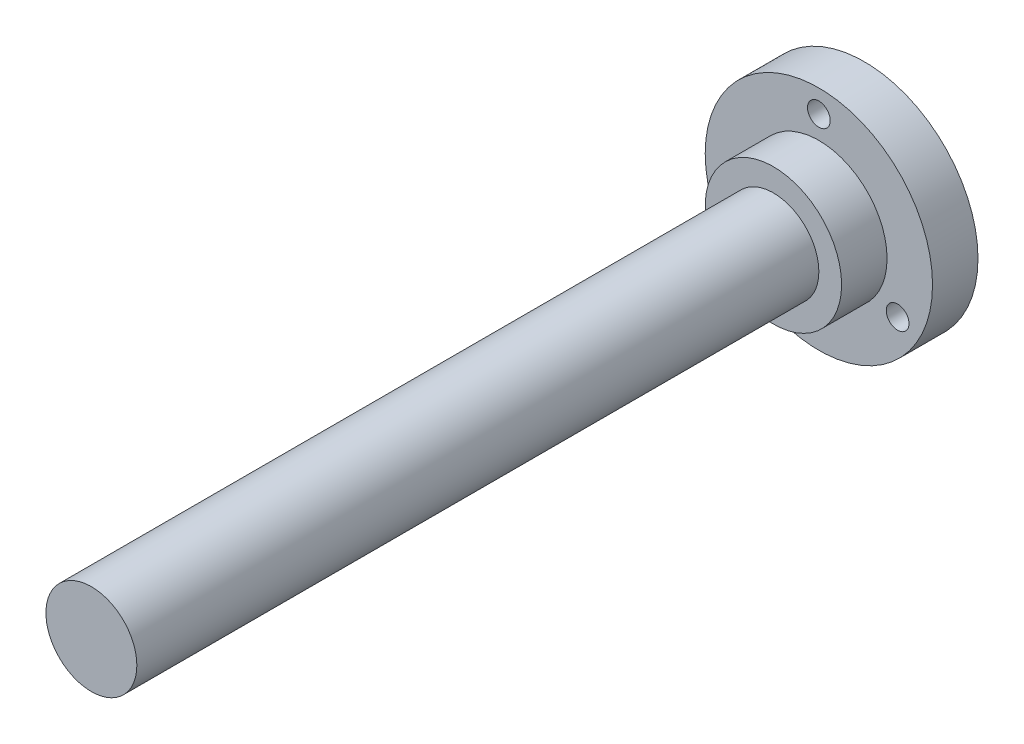
from build123d import *

# Parameters (mm, degrees)
SKETCH1_R           = 25
SKETCH1_R_2         = 2.5
BOSS_EXTRUDE1_DEPTH = 10
SKETCH2_R           = 15
BOSS_EXTRUDE2_DEPTH = 10
SKETCH3_R           = 10
BOSS_EXTRUDE3_DEPTH = 150


with BuildPart() as part:
    # Sketch1 → Boss-Extrude1 (new body)
    with BuildSketch(Plane.XY):
        Circle(SKETCH1_R)
        with Locations((0, 20)):
            Circle(SKETCH1_R_2, mode=Mode.SUBTRACT)
        with Locations((17.320508076, -10)):
            Circle(SKETCH1_R_2, mode=Mode.SUBTRACT)
        with Locations((-17.320508076, -10)):
            Circle(SKETCH1_R_2, mode=Mode.SUBTRACT)
    extrude(amount=BOSS_EXTRUDE1_DEPTH)

    # Sketch2 → Boss-Extrude2 (add)
    with BuildSketch(Plane.XY.offset(10)):
        Circle(SKETCH2_R)
    extrude(amount=BOSS_EXTRUDE2_DEPTH)

    # Sketch3 → Boss-Extrude3 (add)
    with BuildSketch(Plane.XY.offset(20)):
        Circle(SKETCH3_R)
    extrude(amount=BOSS_EXTRUDE3_DEPTH)


solid = part.part
